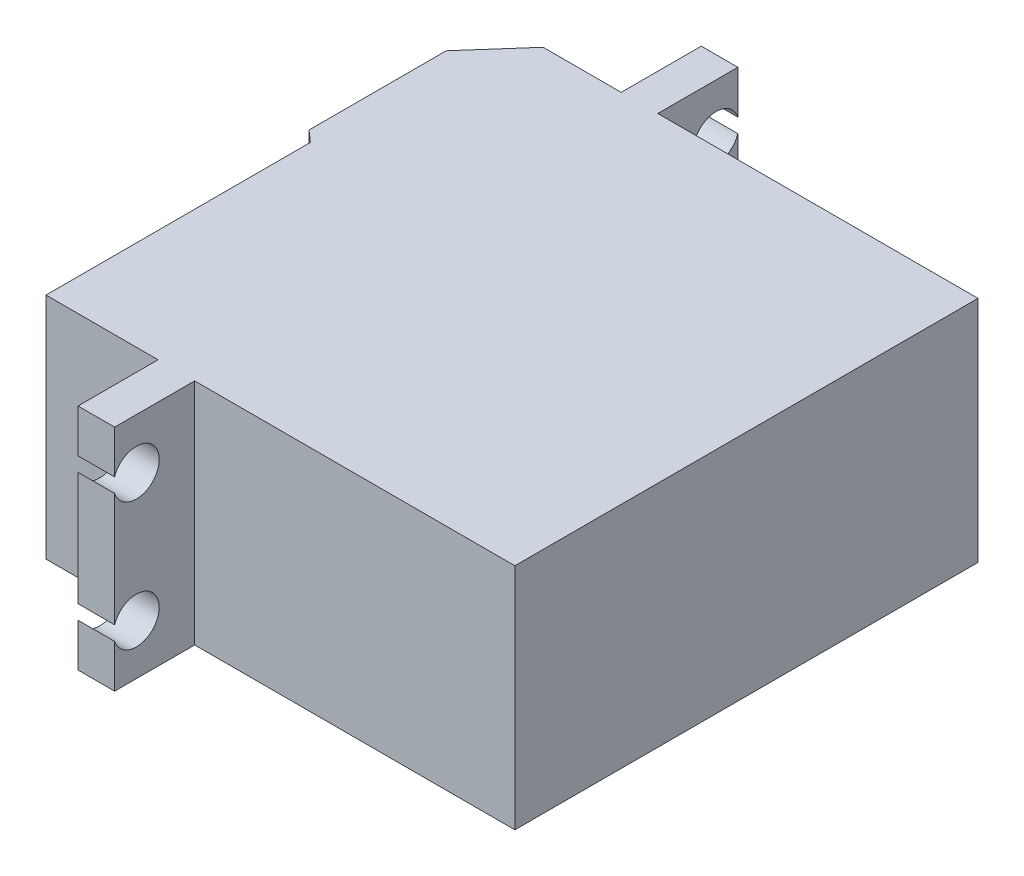
from build123d import *

# Parameters (mm, degrees)
BOSS_EXTRUDE1_DEPTH = 20
BOSS_EXTRUDE2_DEPTH = 4
SKETCH3_R           = 2
CUT_EXTRUDE1_DEPTH  = 61.246908634
SKETCH4_R           = 1.5
CUT_EXTRUDE2_DEPTH  = 2


with BuildPart() as part:
    # Sketch1 → Boss-Extrude1 (new body)
    with BuildSketch(Plane(origin=(0, 0, 0), x_dir=(1, 0, 0), z_dir=(0, 1, 0))):
        Polygon((0, 0), (0, 40.5), (-28, 40.5), (-28, 47.5), (-31.2, 47.5), (-31.2, 40.5), (-38.031373033, 40.5), (-42, 36), (-42, 24), (-41, 23.118082896), (-41, 0), (-31.2, 0), (-31.2, -7), (-28, -7), (-28, 0), align=None)
    extrude(amount=BOSS_EXTRUDE1_DEPTH)

    # Sketch2 → Boss-Extrude2 (add)
    with BuildSketch(Plane.ZY.offset(42)):
        Polygon((-33.464101615, 10), (-31.732050808, 7), (-28.267949192, 7), (-26.535898385, 10), (-28.267949192, 13), (-31.732050808, 13), align=None)
    extrude(amount=BOSS_EXTRUDE2_DEPTH)

    # Sketch3 → Cut-Extrude1 (cut, through all)
    with BuildSketch(Plane.ZY.offset(31.2)):
        with Locations((-45.6, 4.4)):
            Circle(SKETCH3_R)
        with Locations((-45.6, 15.6)):
            Circle(SKETCH3_R)
        with Locations((5.1, 15.6)):
            Circle(SKETCH3_R)
        with Locations((5.1, 4.4)):
            Circle(SKETCH3_R)
    extrude(amount=-CUT_EXTRUDE1_DEPTH, mode=Mode.SUBTRACT)

    # Sketch4 → Cut-Extrude2 (cut)
    with BuildSketch(Plane.ZY.offset(46)):
        with Locations((-30, 10)):
            Circle(SKETCH4_R)
    extrude(amount=-CUT_EXTRUDE2_DEPTH, mode=Mode.SUBTRACT)


solid = part.part
